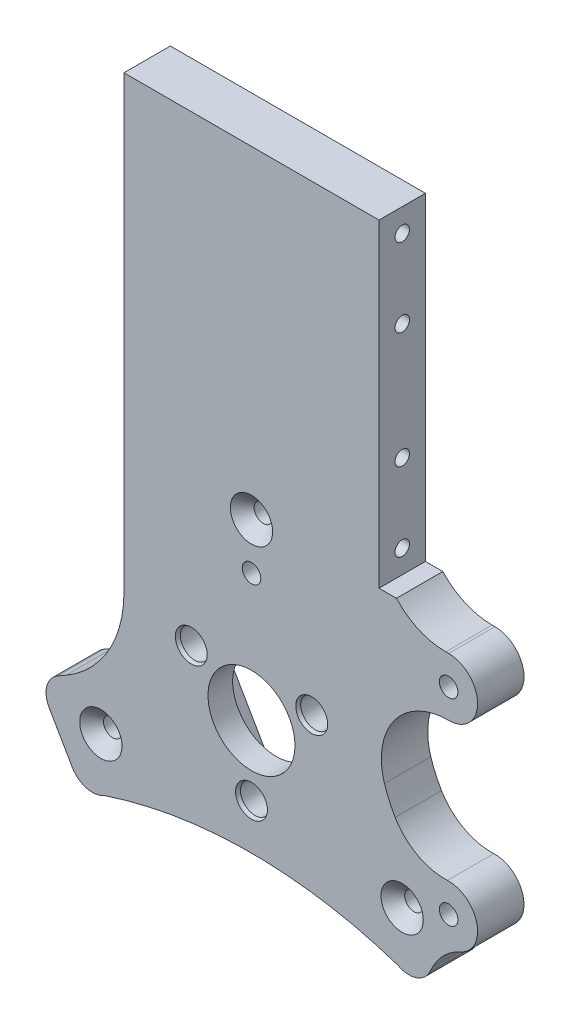
from build123d import *

# Parameters (mm, degrees)
BOSS_EXTRUDE1_DEPTH                             = 8
BOSS_EXTRUDE2_START                             = 3.75
SKETCH1_3_R                                     = 7.5
BOSS_EXTRUDE2_DEPTH                             = 4.25
SKETCH15_W                                      = 44
SKETCH15_H                                      = 8
BOSS_EXTRUDE3_DEPTH                             = 36
SKETCH22_W                                      = 5
SKETCH22_H                                      = 10
CUT_EXTRUDE1_DEPTH                              = 10
CSK_FOR_M3_FLAT_HEAD_MACHINE_SCREW1_D           = 3.2
CSK_FOR_M3_FLAT_HEAD_MACHINE_SCREW1_CSINK_D     = 7.3
CSK_FOR_M3_FLAT_HEAD_MACHINE_SCREW1_CSINK_ANGLE = 90
CBORE_FOR_M3_SBHCS2_AT_2_COUNT                  = 2
CBORE_FOR_M3_SBHCS2_AT_2_PITCH                  = 34
CBORE_FOR_M3_SBHCS2_AT_3_COUNT                  = 2
CBORE_FOR_M3_SBHCS2_AT_3_PITCH                  = 48.083261121
CBORE_FOR_M3_SBHCS2_AT_4_COUNT                  = 2
CBORE_FOR_M3_SBHCS2_AT_4_PITCH                  = 34
CSK_FOR_M4_FLAT_HEAD_MACHINE_SCREW1_D           = 5
CSK_FOR_M4_FLAT_HEAD_MACHINE_SCREW1_CSINK_D     = 5.5
CSK_FOR_M4_FLAT_HEAD_MACHINE_SCREW1_CSINK_ANGLE = 45
FILLET1_R                                       = 10
TAP_DRILL_FOR_M3X0_5_TAP4_AT_2_COUNT            = 2
TAP_DRILL_FOR_M3X0_5_TAP4_AT_2_PITCH            = 13.5
TAP_DRILL_FOR_M3X0_5_TAP4_AT_3_COUNT            = 2
TAP_DRILL_FOR_M3X0_5_TAP4_AT_3_PITCH            = 47
TAP_DRILL_FOR_M3X0_5_TAP4_AT_4_COUNT            = 2
TAP_DRILL_FOR_M3X0_5_TAP4_AT_4_PITCH            = 33.5
CUT_EXTRUDE2_DEPTH                              = 1


with BuildPart() as part:
    # Sketch1 → Boss-Extrude1 (new body)
    with BuildSketch(Plane.XY):
        with BuildLine():
            Line((-34.908965344, -15.535898385), (-30.908965344, -22.464101615))
            ThreePointArc((-30.908965344, -22.464101615), (-28.480139909, -24.32780492), (-25.444863729, -23.92820323))
            ThreePointArc((-25.444863729, -23.92820323), (-0.099802976, -19.807237854), (25.245257776, -23.92820323))
            ThreePointArc((25.245257776, -23.92820323), (28.370669268, -24.230246054), (30.751194283, -22.182679812))
            Line((30.751194283, -22.182679812), (33.327975751, -16.943702652))
            ThreePointArc((33.327975751, -16.943702652), (38.763582033, -10.469765614), (30.583408175, -8.338467401))
            ThreePointArc((30.583408175, -8.338467401), (25.897362485, -3.779012816), (22.93219159, 2.048114425))
            ThreePointArc((22.93219159, 2.048114425), (24.617574432, 12.308222281), (33.890916455, 17.010929616))
            Line((33.890916455, 17.010929616), (34, 17.010929616))
            ThreePointArc((34, 17.010929616), (39.000000252, 22.010929868), (34, 27.01093012))
            Line((34, 27.01093012), (33.494477634, 27.01093012))
            ThreePointArc((33.494477634, 27.01093012), (25.366654553, 30.377584673), (22, 38.505407754))
            Line((22, 38.505407754), (22, 49.757346749))
            Line((22, 49.757346749), (-22, 49.757346749))
            Line((-22, 49.757346749), (-22, 8.082903769))
            ThreePointArc((-22, 8.082903769), (-24.679491924, -1.917096231), (-32, -9.237604307))
            Line((-32, -9.237604307), (-33.444863729, -10.07179677))
            ThreePointArc((-33.444863729, -10.07179677), (-35.308567034, -12.500622204), (-34.908965344, -15.535898385))
        make_face()
        with BuildLine():
            Line((-10.386277084, 10.495620221), (10.386277084, 10.495620221))
            ThreePointArc((10.386277084, 10.495620221), (14.284072501, 8.245422859), (14.284581393, 3.744734354))
            Line((14.284581393, 3.744734354), (3.903550031, -14.242001198))
            ThreePointArc((3.903550031, -14.242001198), (3.3459e-05, -16.496109207), (-3.90351658, -14.242059155))
            Line((-3.90351658, -14.242059155), (-14.284726037, 3.744368131))
            ThreePointArc((-14.284726037, 3.744368131), (-14.284267239, 8.245291146), (-10.386277084, 10.495620221))
        make_face(mode=Mode.SUBTRACT)
    extrude(amount=BOSS_EXTRUDE1_DEPTH)

    # Sketch1<3> → Boss-Extrude2 (add)
    with BuildSketch(Plane.XY.offset(BOSS_EXTRUDE2_START)):
        with BuildLine():
            ThreePointArc((14.284581393, 3.744734354), (14.284072501, 8.245422859), (10.386277084, 10.495620221))
            Line((10.386277084, 10.495620221), (-10.386277084, 10.495620221))
            ThreePointArc((-10.386277084, 10.495620221), (-14.284267239, 8.245291146), (-14.284726037, 3.744368131))
            Line((-14.284726037, 3.744368131), (-12.092701093, -0.053522416))
            Line((-12.092701093, -0.053522416), (-3.90351658, -14.242059155))
            ThreePointArc((-3.90351658, -14.242059155), (3.3459e-05, -16.496109207), (3.903550031, -14.242001198))
            Line((3.903550031, -14.242001198), (14.284581393, 3.744734354))
        make_face()
        Circle(SKETCH1_3_R, mode=Mode.SUBTRACT)
    extrude(amount=BOSS_EXTRUDE2_DEPTH)

    # Sketch15 → Boss-Extrude3 (add)
    with BuildSketch(Plane(origin=(0, 49.757346749, 0), x_dir=(1, 0, 0), z_dir=(0, 1, 0))):
        with Locations((0, -4)):
            Rectangle(SKETCH15_W, SKETCH15_H)
    extrude(amount=BOSS_EXTRUDE3_DEPTH)

    # Sketch4 → Cut-Revolve1 (revolve, cut)
    with BuildSketch(Plane(origin=(0, 0, 0), x_dir=(-1, 0, 0), z_dir=(0, 0, -1))):
        with BuildLine():
            Line((0, 26), (0, 34))
            ThreePointArc((0, 34), (4, 30), (0, 26))
        make_face()
    revolve(axis=Axis((0, 26, 0), (0, 1, 0)), mode=Mode.SUBTRACT)

    # Sketch22 → Cut-Extrude1 (cut)
    with BuildSketch(Plane.XY.offset(8)):
        with Locations((24.5, 35.757346749)):
            Rectangle(SKETCH22_W, SKETCH22_H)
    extrude(amount=-CUT_EXTRUDE1_DEPTH, mode=Mode.SUBTRACT)

    # Sketch5 → Cut-Revolve2 (revolve, cut)
    with BuildSketch(Plane(origin=(0, 0, 0), x_dir=(-1, 0, 0), z_dir=(0, 0, -1))):
        with BuildLine():
            Line((-22.516660498, -13), (-29.444863729, -17))
            ThreePointArc((-29.444863729, -17), (-27.980762114, -11.535898385), (-22.516660498, -13))
        make_face()
    revolve(axis=Axis((22.516660498, -13, 0), (0.8660254037844364, -0.5000000000000041, 0)), mode=Mode.SUBTRACT)

    # Sketch6 → Cut-Revolve3 (revolve, cut)
    with BuildSketch(Plane(origin=(0, 0, 0), x_dir=(-1, 0, 0), z_dir=(0, 0, -1))):
        with BuildLine():
            Line((22.516660498, -13), (29.444863729, -17))
            ThreePointArc((29.444863729, -17), (23.980762114, -18.464101615), (22.516660498, -13))
        make_face()
    revolve(axis=Axis((-22.516660498, -13, 0), (-0.8660254037844433, -0.49999999999999206, 0)), mode=Mode.SUBTRACT)

    # CSK for M3 Flat Head Machine Screw1 (through all)
    with Locations(Plane.XY.offset(8)):
        with Locations((0, 30), (25.980762114, -15), (-25.980762114, -15)):
            CounterSinkHole(CSK_FOR_M3_FLAT_HEAD_MACHINE_SCREW1_D / 2, CSK_FOR_M3_FLAT_HEAD_MACHINE_SCREW1_CSINK_D / 2, counter_sink_angle=CSK_FOR_M3_FLAT_HEAD_MACHINE_SCREW1_CSINK_ANGLE)

    # Sketch12 → CBORE for M3 SBHCS2 (revolve, cut)
    with BuildSketch(Plane(origin=(34, 22.010929787, 0), x_dir=(0, 1, 0), z_dir=(1, 0, 0))):
        Polygon((0, 0), (0, 8), (1.6, 8), (1.6, 3), (3.35, 3), (3.35, 0.025), (3.375, 0), align=None)
    cbore_for_m3_sbhcs2 = revolve(axis=Axis((34, 22.010929787, -6.35), (0, 0, 1)), mode=Mode.SUBTRACT)

    # CBORE for M3 SBHCS2 at 2: CBORE for M3 SBHCS2 ×2
    with Locations(*[(-i * CBORE_FOR_M3_SBHCS2_AT_2_PITCH, 0, 0) for i in range(1, CBORE_FOR_M3_SBHCS2_AT_2_COUNT)]):
        add(cbore_for_m3_sbhcs2, mode=Mode.SUBTRACT)

    # CBORE for M3 SBHCS2 at 3: CBORE for M3 SBHCS2 ×2
    with Locations(*[Vector(-0.7071067811865438, -0.7071067811865512, 0) * (i * CBORE_FOR_M3_SBHCS2_AT_3_PITCH) for i in range(1, CBORE_FOR_M3_SBHCS2_AT_3_COUNT)]):
        add(cbore_for_m3_sbhcs2, mode=Mode.SUBTRACT)

    # CBORE for M3 SBHCS2 at 4: CBORE for M3 SBHCS2 ×2
    with Locations(*[(0, -i * CBORE_FOR_M3_SBHCS2_AT_4_PITCH, 0) for i in range(1, CBORE_FOR_M3_SBHCS2_AT_4_COUNT)]):
        add(cbore_for_m3_sbhcs2, mode=Mode.SUBTRACT)

    # CSK for M4 Flat Head Machine Screw1 (through all)
    with Locations(Plane.XY.offset(8)):
        with Locations((-10.386277084, 5.994432277), (10.386277084, 5.994637855), (0, -11.989070132)):
            CounterSinkHole(CSK_FOR_M4_FLAT_HEAD_MACHINE_SCREW1_D / 2, CSK_FOR_M4_FLAT_HEAD_MACHINE_SCREW1_CSINK_D / 2, counter_sink_angle=CSK_FOR_M4_FLAT_HEAD_MACHINE_SCREW1_CSINK_ANGLE)

    # Fillet1
    fillet1_edges = [part.edges().sort_by_distance(p)[0] for p in [
        (30.583408175, -8.338467401, 4),
        (33.327975751, -16.943702652, 4),
    ]]
    fillet(fillet1_edges, radius=FILLET1_R)

    # Sketch26 → Tap Drill for M3x0.5 Tap4 (revolve, cut)
    with BuildSketch(Plane(origin=(22, 81.757346749, 4), x_dir=(0, 0, -1), z_dir=(0, 1, 0))):
        Polygon((0, 0), (0, 5.751075774), (1.25, 5), (1.25, 0), align=None)
    tap_drill_for_m3x0_5_tap4 = revolve(axis=Axis((28.35, 81.757346749, 4), (-1, 0, 0)), mode=Mode.SUBTRACT)

    # Tap Drill for M3x0.5 Tap4 at 2: Tap Drill for M3x0.5 Tap4 ×2
    with Locations(*[(0, -i * TAP_DRILL_FOR_M3X0_5_TAP4_AT_2_PITCH, 0) for i in range(1, TAP_DRILL_FOR_M3X0_5_TAP4_AT_2_COUNT)]):
        add(tap_drill_for_m3x0_5_tap4, mode=Mode.SUBTRACT)

    # Tap Drill for M3x0.5 Tap4 at 3: Tap Drill for M3x0.5 Tap4 ×2
    with Locations(*[(0, -i * TAP_DRILL_FOR_M3X0_5_TAP4_AT_3_PITCH, 0) for i in range(1, TAP_DRILL_FOR_M3X0_5_TAP4_AT_3_COUNT)]):
        add(tap_drill_for_m3x0_5_tap4, mode=Mode.SUBTRACT)

    # Tap Drill for M3x0.5 Tap4 at 4: Tap Drill for M3x0.5 Tap4 ×2
    with Locations(*[(0, -i * TAP_DRILL_FOR_M3X0_5_TAP4_AT_4_PITCH, 0) for i in range(1, TAP_DRILL_FOR_M3X0_5_TAP4_AT_4_COUNT)]):
        add(tap_drill_for_m3x0_5_tap4, mode=Mode.SUBTRACT)

    # Mirror1: Tap Drill for M3x0.5 Tap4 across plane
    add(tap_drill_for_m3x0_5_tap4.mirror(Plane(origin=(0, 0, 0), x_dir=(0, 0, 1), z_dir=(1, 0, 0))), mode=Mode.SUBTRACT)

    # Mirror1 copy 1 sketch → Mirror1 copy 1 (revolve, cut)
    with BuildSketch(Plane(origin=(-22, 68.257346749, 4), x_dir=(0, 0, -1), z_dir=(0, 1, 0))):
        Polygon((0, 0), (0, -5.751075774), (1.25, -5), (1.25, 0), align=None)
    revolve(axis=Axis((-28.35, 68.257346749, 4), (-1, 0, 0)), mode=Mode.SUBTRACT)

    # Mirror1 copy 2 sketch → Mirror1 copy 2 (revolve, cut)
    with BuildSketch(Plane(origin=(-22, 34.757346749, 4), x_dir=(0, 0, -1), z_dir=(0, 1, 0))):
        Polygon((0, 0), (0, -5.751075774), (1.25, -5), (1.25, 0), align=None)
    revolve(axis=Axis((-28.35, 34.757346749, 4), (-1, 0, 0)), mode=Mode.SUBTRACT)

    # Mirror1 copy 3 sketch → Mirror1 copy 3 (revolve, cut)
    with BuildSketch(Plane(origin=(-22, 48.257346749, 4), x_dir=(0, 0, -1), z_dir=(0, 1, 0))):
        Polygon((0, 0), (0, -5.751075774), (1.25, -5), (1.25, 0), align=None)
    revolve(axis=Axis((-28.35, 48.257346749, 4), (-1, 0, 0)), mode=Mode.SUBTRACT)

    # Sketch27 → Cut-Extrude2 (cut)
    # profile 1 of 6: a face of its own
    with BuildSketch(Plane(origin=(0, 0, 0), x_dir=(-1, 0, 0), z_dir=(0, 0, -1))):
        Polygon((-19.567307692, 78.089783713), (-18.221153846, 78.089783713), (-18.221153846, 75.205168328), (-15.625, 75.205168328), (-15.625, 78.089783713), (-14.278846154, 78.089783713), (-14.278846154, 70.589783713), (-15.625, 70.589783713), (-15.625, 73.859014482), (-18.221153846, 73.859014482), (-18.221153846, 70.589783713), (-19.567307692, 70.589783713), align=None)
    # profile 2 of 6: a face of its own
    with BuildSketch(Plane(origin=(0, 0, 0), x_dir=(-1, 0, 0), z_dir=(0, 0, -1))):
        Polygon((-12.548076923, 78.089783713), (-8.509615385, 78.089783713), (-8.509615385, 76.743629867), (-11.201923077, 76.743629867), (-11.201923077, 75.301322174), (-8.509615385, 75.301322174), (-8.509615385, 73.955168328), (-11.201923077, 73.955168328), (-11.201923077, 71.935937559), (-8.509615385, 71.935937559), (-8.509615385, 70.589783713), (-12.548076923, 70.589783713), align=None)
    # profile 3 of 6: a face of its own
    with BuildSketch(Plane(origin=(0, 0, 0), x_dir=(-1, 0, 0), z_dir=(0, 0, -1))):
        Polygon((-6.570012019, 78.089783713), (-5.172776442, 78.089783713), (-3.461538462, 72.858413521), (-1.73828125, 78.089783713), (-0.354567308, 78.089783713), (0.913461538, 70.589783713), (-0.44921875, 70.589783713), (-1.25, 75.32686304), (-2.809495192, 70.589783713), (-4.122596154, 70.589783713), (-5.673076923, 75.32686304), (-6.472355769, 70.589783713), (-7.836538462, 70.589783713), align=None)
    # profile 4 of 6: a face of its own
    with BuildSketch(Plane(origin=(0, 0, 0), x_dir=(-1, 0, 0), z_dir=(0, 0, -1))):
        Polygon((2.163461538, 78.089783713), (6.201923077, 78.089783713), (6.201923077, 76.743629867), (3.509615385, 76.743629867), (3.509615385, 75.301322174), (6.201923077, 75.301322174), (6.201923077, 73.955168328), (3.509615385, 73.955168328), (3.509615385, 71.935937559), (6.201923077, 71.935937559), (6.201923077, 70.589783713), (2.163461538, 70.589783713), align=None)
    # profile 5 of 6: a face of its own
    with BuildSketch(Plane(origin=(0, 0, 0), x_dir=(-1, 0, 0), z_dir=(0, 0, -1))):
        with BuildLine():
            Line((7.548076923, 78.089783713), (9.116586538, 78.089783713))
            add(Edge.make_bspline(
                [(9.116586538, 78.089783713), (9.220264547, 78.089415715), (9.419666561, 78.088707953), (9.707193374, 78.077541332), (9.971326293, 78.062002063), (10.212456392, 78.038288725), (10.430480509, 78.006847706), (10.625617157, 77.969783947), (10.797860632, 77.927541848), (10.94866357, 77.874904859), (11.084755764, 77.815531134), (11.211612609, 77.747309635), (11.332032756, 77.671000031), (11.445211326, 77.584594408), (11.552131869, 77.489647183), (11.652996094, 77.386062782), (11.746378699, 77.272962853), (11.831701453, 77.151062042), (11.909466275, 77.022825185), (11.978194068, 76.88807621), (12.034083624, 76.74672141), (12.083468037, 76.600803667), (12.119038031, 76.448237058), (12.14377644, 76.290506844), (12.161888936, 76.127057799), (12.162930318, 76.016017774), (12.163461538, 75.959375059)],
                knots=[0, 0, 0, 0, 1.749336639, 3.364467119, 4.854658419, 6.213483162, 7.451590619, 8.570285859, 9.5643256, 10.440900261, 11.26203566, 12.067320669, 12.869050712, 13.665104639, 14.467235401, 15.27997916, 16.102287765, 16.939272006, 17.78853747, 18.631303466, 19.488103222, 20.351255419, 21.228522269, 22.127379805, 23.044756219, 24, 24, 24, 24], degree=3))
            add(Edge.make_bspline(
                [(12.163461538, 75.959375059), (12.16208162, 75.900253076), (12.15937585, 75.784325644), (12.144801103, 75.6140377), (12.118163044, 75.451118107), (12.077815829, 75.296043873), (12.031441945, 75.146884918), (11.969776575, 75.006393318), (11.900181111, 74.872525826), (11.817524611, 74.747176049), (11.726813141, 74.627559718), (11.621317609, 74.518259778), (11.507872506, 74.413401772), (11.380100669, 74.319553648), (11.243634399, 74.230369737), (11.095762255, 74.149545363), (10.937449302, 74.075048787), (10.826147455, 74.03350435), (10.769230769, 74.012259674)],
                knots=[0, 0, 0, 0, 1.099860209, 2.156625411, 3.176576793, 4.16617041, 5.135385252, 6.078461593, 7.016046972, 7.938469504, 8.868247731, 9.803980173, 10.76021508, 11.73834243, 12.748633912, 13.790971185, 14.870363756, 16, 16, 16, 16], degree=3))
            Line((10.769230769, 74.012259674), (12.5, 70.589783713))
            Line((12.5, 70.589783713), (11.003605769, 70.589783713))
            Line((11.003605769, 70.589783713), (9.350961538, 73.859014482))
            Line((9.350961538, 73.859014482), (8.894230769, 73.859014482))
            Line((8.894230769, 73.859014482), (8.894230769, 70.589783713))
            Line((8.894230769, 70.589783713), (7.548076923, 70.589783713))
            Line((7.548076923, 70.589783713), (7.548076923, 78.089783713))
        make_face()
        with BuildLine():
            Line((8.894230769, 75.205168328), (9.418569712, 75.205168328))
            add(Edge.make_bspline(
                [(9.418569712, 75.205168328), (9.482674506, 75.20589032), (9.605421412, 75.207272778), (9.781947586, 75.213685192), (9.942275451, 75.229135941), (10.087093509, 75.248657385), (10.217130471, 75.271197711), (10.331226454, 75.303499367), (10.431139503, 75.33811141), (10.515685645, 75.3811252), (10.587919925, 75.430041208), (10.650289603, 75.48561101), (10.701878269, 75.54992598), (10.744338373, 75.621238314), (10.777367717, 75.700178753), (10.801476609, 75.785880709), (10.814949913, 75.879320438), (10.816500063, 75.943806574), (10.817307692, 75.977403905)],
                knots=[0, 0, 0, 0, 1.688639943, 3.233382647, 4.650958383, 5.928841754, 7.082724185, 8.122798841, 9.049171256, 9.863274652, 10.613301712, 11.341792392, 12.054588806, 12.776240173, 13.521029143, 14.301969904, 15.115324896, 16, 16, 16, 16], degree=3))
            add(Edge.make_bspline(
                [(10.817307692, 75.977403905), (10.815780795, 76.017152), (10.812781489, 76.095229768), (10.783019051, 76.207634376), (10.73564368, 76.311672531), (10.670705021, 76.406874163), (10.588923224, 76.490334485), (10.495072158, 76.563905424), (10.387126293, 76.622079818), (10.287176545, 76.660451029), (10.196245636, 76.68340892), (10.11418336, 76.700516938), (10.01915475, 76.712641881), (9.911088065, 76.725502541), (9.790258771, 76.733842028), (9.656008275, 76.739928192), (9.508722145, 76.74241834), (9.406049723, 76.743214397), (9.352463942, 76.743629867)],
                knots=[0, 0, 0, 0, 1.020303359, 2.004196876, 2.966617323, 3.9489082, 4.950758222, 5.960522915, 7.003732012, 8.091992268, 8.70421221, 9.413913587, 10.24622431, 11.166358409, 12.212345909, 13.359657661, 14.621978493, 16, 16, 16, 16], degree=3))
            Line((9.352463942, 76.743629867), (8.894230769, 76.743629867))
            Line((8.894230769, 76.743629867), (8.894230769, 75.205168328))
        make_face(mode=Mode.SUBTRACT)
    # profile 6 of 6: a face of its own
    with BuildSketch(Plane(origin=(0, 0, 0), x_dir=(-1, 0, 0), z_dir=(0, 0, -1))):
        Polygon((15.914963942, 78.089783713), (17.163461538, 78.089783713), (20.192307692, 70.589783713), (18.754507212, 70.589783713), (18.171574519, 72.128245251), (14.903846154, 72.128245251), (14.320913462, 70.589783713), (12.884615385, 70.589783713), align=None)
        Polygon((16.538461538, 76.078064963), (15.414663462, 73.474399097), (17.662259615, 73.474399097), align=None, mode=Mode.SUBTRACT)
    extrude(amount=-CUT_EXTRUDE2_DEPTH, mode=Mode.SUBTRACT)


solid = part.part
